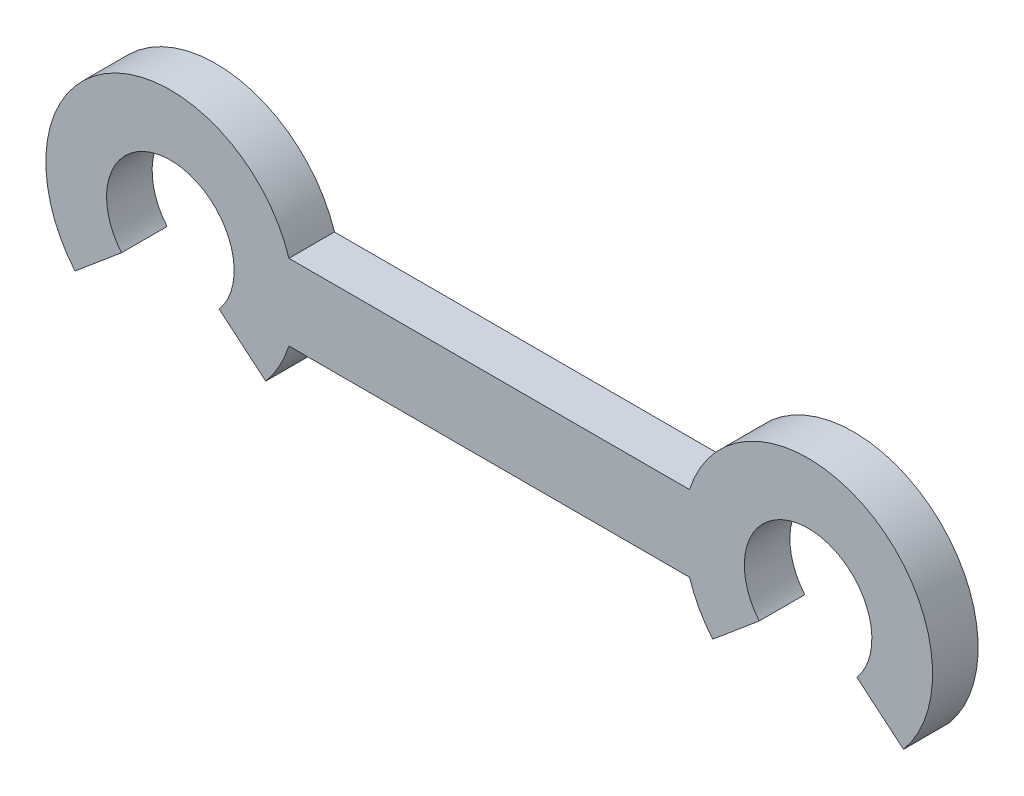
from build123d import *

# Parameters (mm, degrees)
BOSS_EXTRU_1_DEPTH = 1.5


with BuildPart() as part:
    # Esquisse1 → Boss.-Extru.1 (new body)
    with BuildSketch(Plane.XY):
        with BuildLine():
            Line((-13.640782217, -2.6354292), (-12.108693331, -1.34985398))
            ThreePointArc((-12.108693331, -1.34985398), (-10.5, 2.1), (-8.891306669, -1.34985398))
            Line((-8.891306669, -1.34985398), (-7.359217783, -2.6354292))
            ThreePointArc((-7.359217783, -2.6354292), (-6.909745499, -1.979917326), (-6.595195267, -1.25))
            Line((-6.595195267, -1.25), (6.595195267, -1.25))
            ThreePointArc((6.595195267, -1.25), (6.909745499, -1.979917326), (7.359217783, -2.6354292))
            Line((7.359217783, -2.6354292), (8.891306669, -1.34985398))
            ThreePointArc((8.891306669, -1.34985398), (10.5, 2.1), (12.108693331, -1.34985398))
            Line((12.108693331, -1.34985398), (13.640782217, -2.6354292))
            ThreePointArc((13.640782217, -2.6354292), (12.479917326, 3.590254501), (6.595195267, 1.25))
            Line((6.595195267, 1.25), (-6.595195267, 1.25))
            ThreePointArc((-6.595195267, 1.25), (-12.479917326, 3.590254501), (-13.640782217, -2.6354292))
        make_face()
    extrude(amount=BOSS_EXTRU_1_DEPTH)


solid = part.part
